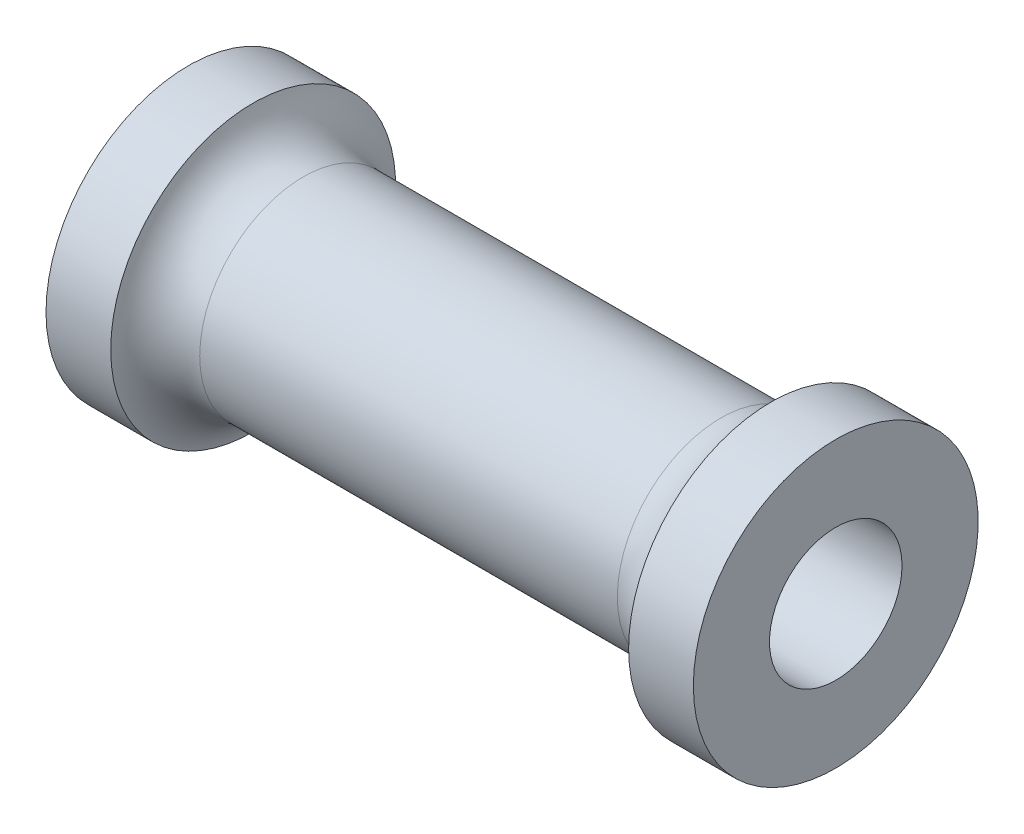
from build123d import *

# Parameters (mm, degrees)
FILLET1_R          = 2.54
SKETCH2_R          = 3.25
CUT_EXTRUDE1_DEPTH = 34.251209752


with BuildPart() as part:
    # Sketch1 → Revolve1 (revolve)
    with BuildSketch(Plane.XY, mode=Mode.PRIVATE) as revolve1_sk:
        Polygon((15.875, 0), (15.875, 6.985), (12.7, 6.985), (12.7, 5.08), (0, 5.08), (0, 0), align=None)
    revolve1 = revolve(revolve1_sk.sketch.rotate(Axis((0, 0, 0), (1, 0, 0)), 90), axis=Axis((0, 0, 0), (1, 0, 0)))

    # Mirror1: Revolve1 across plane
    add(revolve1.mirror(Plane(origin=(0, 0, 0), x_dir=(0, 0, 1), z_dir=(1, 0, 0))))

    # Fillet1
    # the kernel refuses this fillet: 2.54 mm, written as the material it adds along each edge
    with BuildSketch(Plane(origin=(-12.7, 0, 0), x_dir=(0, 0, 1), z_dir=(0, 1, 0))) as fillet1_piece_1:
        with BuildLine():
            CenterArc((7.62, 2.459344425), FILLET1_R, 180, 75.522487814)
            Line((6.985, 0), (6.9723, -0.049186888))
            ThreePointArc((6.9723, -0.049186888), (6.0325, -0.0508), (5.08, -0.0508))
            Line((5.08, -0.0508), (5.0292, 0))
            Line((5.0292, 0), (5.0292, 2.459344425))
            Line((5.0292, 2.459344425), (5.08, 2.459344425))
        make_face()
    revolve(axis=Axis((-12.7, 0, 0), (1, 0, 0)))
    with BuildSketch(Plane(origin=(12.7, 0, 0), x_dir=(0, 0, 1), z_dir=(0, 1, 0))) as fillet1_piece_2:
        with BuildLine():
            CenterArc((7.62, -2.459344425), FILLET1_R, 104.477512186, 75.522487814)
            Line((5.08, -2.459344425), (5.0292, -2.459344425))
            Line((5.0292, -2.459344425), (5.0292, 0))
            Line((5.0292, 0), (5.08, 0.0508))
            ThreePointArc((5.08, 0.0508), (6.0325, 0.0508), (6.9723, 0.049186888))
            Line((6.9723, 0.049186888), (6.985, 0))
        make_face()
    revolve(axis=Axis((12.7, 0, 0), (1, 0, 0)))

    # Sketch2 → Cut-Extrude1 (cut, through all)
    with BuildSketch(Plane(origin=(15.875, 0, 0), x_dir=(0, 0, -1), z_dir=(1, 0, 0))):
        Circle(SKETCH2_R)
    extrude(amount=-CUT_EXTRUDE1_DEPTH, mode=Mode.SUBTRACT)


solid = part.part
